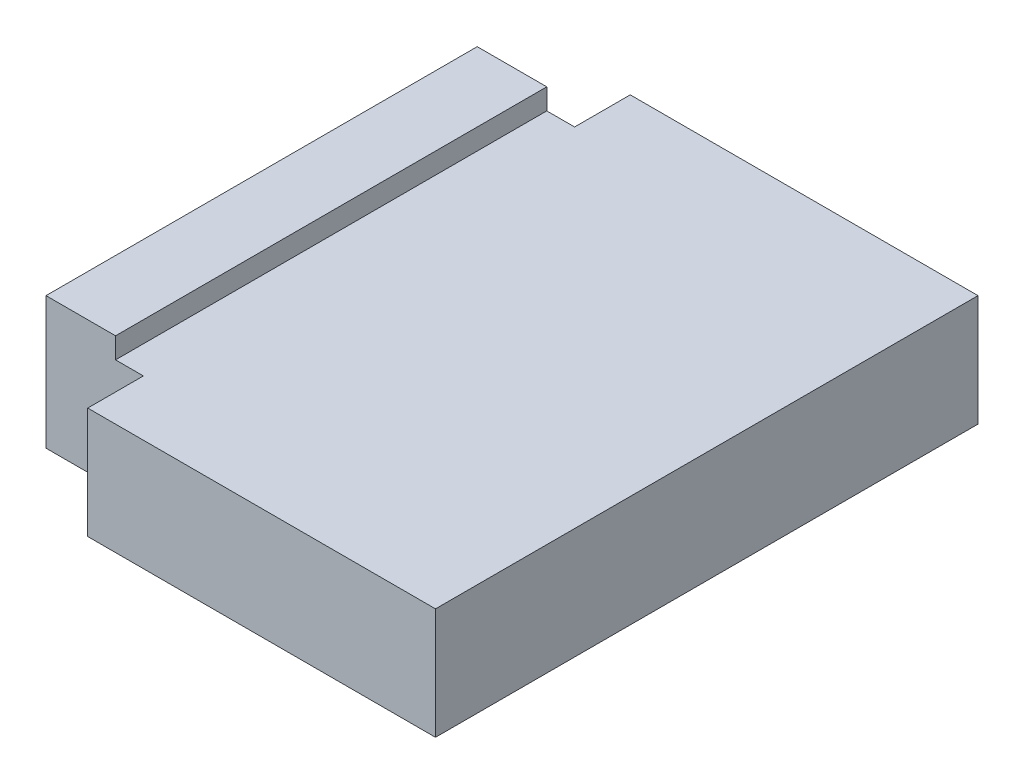
from build123d import *

# Parameters (mm, degrees)
EXTRUDE_2_DEPTH = 16
SKETCH_5_W      = 10
SKETCH_5_H      = 62
EXTRUDE_3_DEPTH = 3


with BuildPart() as part:
    # 草图2 → 凸台-拉伸2 (new body)
    with BuildSketch(Plane(origin=(0, 0, 0), x_dir=(1, 0, 0), z_dir=(0, 1, 0))):
        Polygon((32, 39), (-18, 39), (-18, 31), (-32, 31), (-32, -31), (-18, -31), (-18, -39), (32, -39), align=None)
    extrude(amount=EXTRUDE_2_DEPTH)

    # 草图5 → 凸台-拉伸3 (add)
    with BuildSketch(Plane(origin=(0, 16, 0), x_dir=(1, 0, 0), z_dir=(0, 1, 0))):
        with Locations((-27, 0)):
            Rectangle(SKETCH_5_W, SKETCH_5_H)
    extrude(amount=EXTRUDE_3_DEPTH)


solid = part.part
